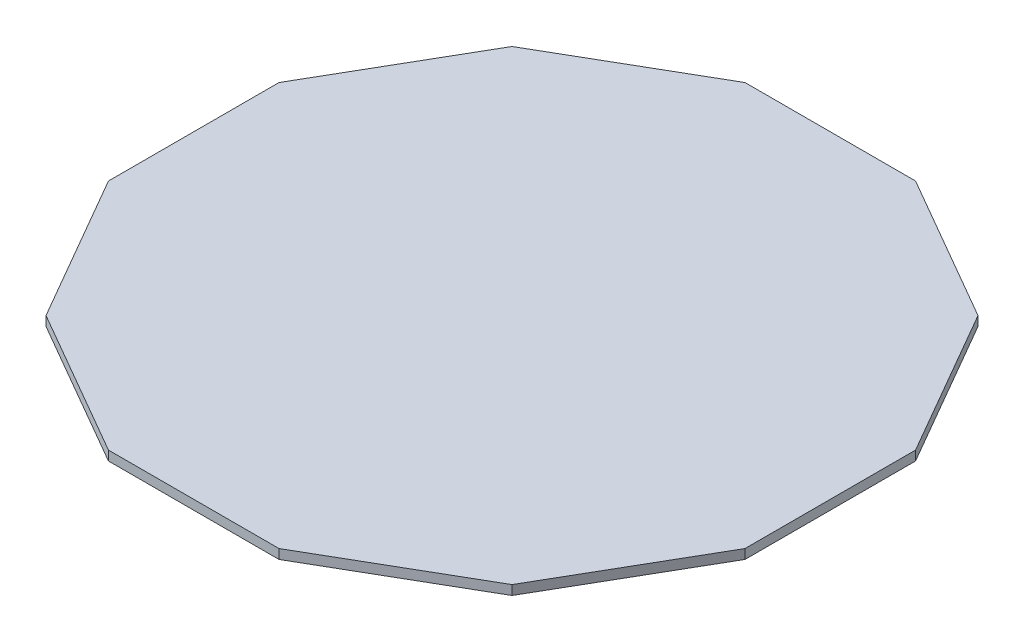
from build123d import *

# Parameters (mm, degrees)
BOSS_EXTRUDE1_DEPTH = 2.921


with BuildPart() as part:
    # Sketch1 → Boss-Extrude1 (new body)
    with BuildSketch(Plane(origin=(0, 0, 0), x_dir=(1, 0, 0), z_dir=(0, 1, 0))):
        Polygon((71.842048969, 71.842048969), (26.296014982, 98.138063951), (-26.296014982, 98.138063951), (-71.842048969, 71.842048969), (-98.138063951, 26.296014982), (-98.138063951, -26.296014982), (-71.842048969, -71.842048969), (-26.296014982, -98.138063951), (26.296014982, -98.138063951), (71.842048969, -71.842048969), (98.138063951, -26.296014982), (98.138063951, 26.296014982), align=None)
    extrude(amount=-BOSS_EXTRUDE1_DEPTH)


solid = part.part
